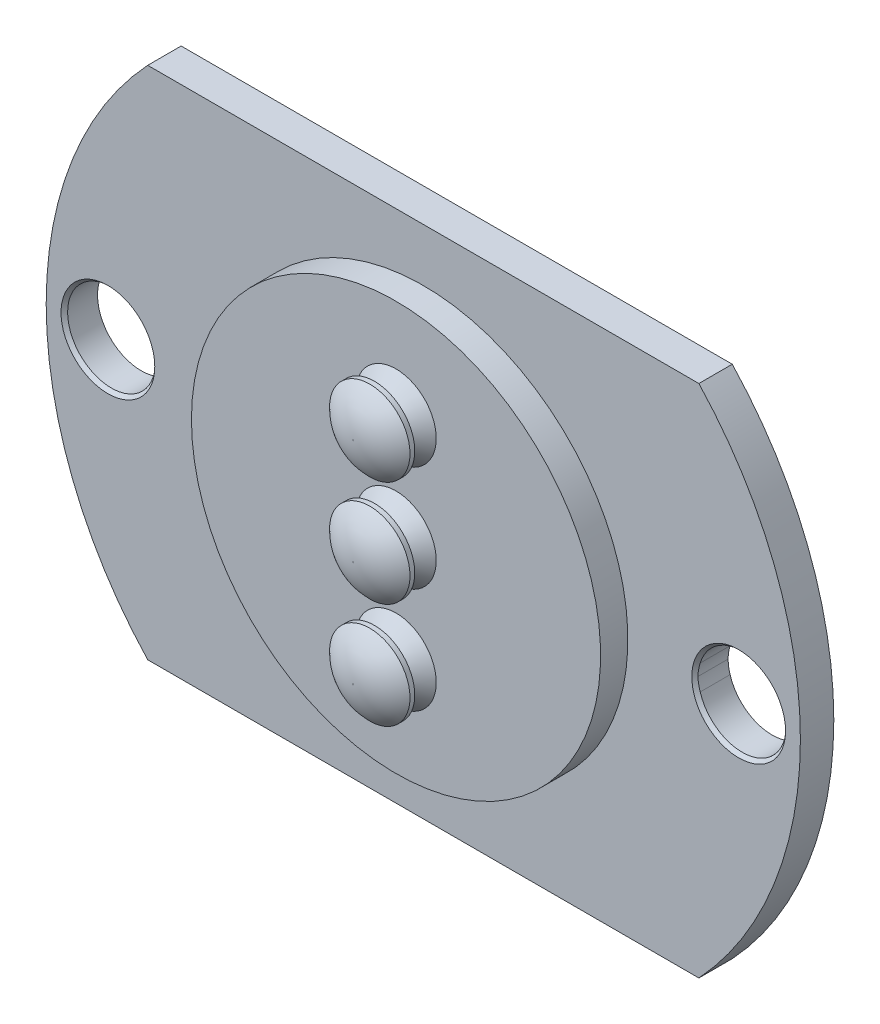
from build123d import *

# Parameters (mm, degrees)
CUT_EXTRUDE1_START                             = -7.3406
CUT_EXTRUDE1_OUTLINE_R                         = 1.4986
CUT_EXTRUDE1_DEPTH                             = 1.2446
CUT_EXTRUDE1_START_2                           = -8.3566
CUT_EXTRUDE1_2_OUTLINE_R                       = 6.985
CUT_EXTRUDE1_2_DEPTH                           = 3.5306
CUT_EXTRUDE1_START_3                           = -9.9568
CUT_EXTRUDE1_3_OUTLINE_R                       = 1.4986
CUT_EXTRUDE1_3_OUTLINE_R_2                     = 1.1176
CUT_EXTRUDE1_3_DEPTH                           = 9.9568
CUT_EXTRUDE1_4_OUTLINE_R                       = 7.62
CUT_EXTRUDE1_4_OUTLINE_R_2                     = 6.985
CUT_EXTRUDE1_4_DEPTH                           = 1.016
CUT_EXTRUDE1_5_OUTLINE_R                       = 1.1176
CUT_EXTRUDE1_5_DEPTH                           = 1.6002
CUT_EXTRUDE1_START_4                           = -4.826
CUT_EXTRUDE1_6_OUTLINE_R                       = 1.4986
CUT_EXTRUDE1_6_DEPTH                           = 0.508
CUT_EXTRUDE2_DEPTH                             = 19.066440786
CUT_EXTRUDE2_DEPTH_BACK                        = 19.066440786
SKETCH7_R                                      = 0.635
CUT_EXTRUDE3_DEPTH                             = 19.06644082
LPATTERN1_COUNT                                = 3
LPATTERN1_PITCH                                = 3.937
CSK_FOR_4_FLAT_HEAD_MACHINE_SCREW1_D           = 3.2639
CSK_FOR_4_FLAT_HEAD_MACHINE_SCREW1_CSINK_D     = 3.4925
CSK_FOR_4_FLAT_HEAD_MACHINE_SCREW1_CSINK_ANGLE = 82


with BuildPart() as part:
    # Cut-Extrude1: read off the stored shape, not the designer's step
    # Cut-Extrude1 outline → Cut-Extrude1 (new body)
    with BuildSketch(Plane(origin=(0, 0, -6.096), x_dir=(-1, 0, 0), z_dir=(0, 0, -1)).offset(CUT_EXTRUDE1_START)):
        with BuildLine():
            ThreePointArc((10.26432668, -9.5885), (14.0462, 0), (10.26432668, 9.5885))
            Line((10.26432668, 9.5885), (-10.26432668, 9.5885))
            ThreePointArc((-10.26432668, 9.5885), (-14.0462, 0), (-10.26432668, -9.5885))
            Line((-10.26432668, -9.5885), (10.26432668, -9.5885))
        make_face()
        with Locations((-11.6078, 0)):
            Circle(CUT_EXTRUDE1_OUTLINE_R, mode=Mode.SUBTRACT)
        with Locations((11.6078, 0)):
            Circle(CUT_EXTRUDE1_OUTLINE_R, mode=Mode.SUBTRACT)
    extrude(amount=CUT_EXTRUDE1_DEPTH)

    # Cut-Extrude1 2 outline → Cut-Extrude1 2 (add)
    with BuildSketch(Plane(origin=(0, 0, -6.096), x_dir=(-1, 0, 0), z_dir=(0, 0, -1)).offset(CUT_EXTRUDE1_START_2)):
        Circle(CUT_EXTRUDE1_2_OUTLINE_R)
    extrude(amount=CUT_EXTRUDE1_2_DEPTH)

    # Cut-Extrude1 3 outline → Cut-Extrude1 3 (add)
    # profile 1 of 3: a face of its own
    with BuildSketch(Plane(origin=(0, 0, -6.096), x_dir=(-1, 0, 0), z_dir=(0, 0, -1)).offset(CUT_EXTRUDE1_START_3)):
        with Locations((0, -3.937)):
            Circle(CUT_EXTRUDE1_3_OUTLINE_R)
        with Locations((0, -3.937)):
            Circle(CUT_EXTRUDE1_3_OUTLINE_R_2, mode=Mode.SUBTRACT)
    # profile 2 of 3: a face of its own
    with BuildSketch(Plane(origin=(0, 0, -6.096), x_dir=(-1, 0, 0), z_dir=(0, 0, -1)).offset(CUT_EXTRUDE1_START_3)):
        Circle(CUT_EXTRUDE1_3_OUTLINE_R)
        Circle(CUT_EXTRUDE1_3_OUTLINE_R_2, mode=Mode.SUBTRACT)
    # profile 3 of 3: a face of its own
    with BuildSketch(Plane(origin=(0, 0, -6.096), x_dir=(-1, 0, 0), z_dir=(0, 0, -1)).offset(CUT_EXTRUDE1_START_3)):
        with Locations((0, 3.937)):
            Circle(CUT_EXTRUDE1_3_OUTLINE_R)
        with Locations((0, 3.937)):
            Circle(CUT_EXTRUDE1_3_OUTLINE_R_2, mode=Mode.SUBTRACT)
    extrude(amount=CUT_EXTRUDE1_3_DEPTH)

    # Cut-Extrude1 4 outline → Cut-Extrude1 4 (add)
    with BuildSketch(Plane(origin=(0, 0, -6.096), x_dir=(-1, 0, 0), z_dir=(0, 0, -1)).offset(CUT_EXTRUDE1_START_2)):
        Circle(CUT_EXTRUDE1_4_OUTLINE_R)
        Circle(CUT_EXTRUDE1_4_OUTLINE_R_2, mode=Mode.SUBTRACT)
    extrude(amount=CUT_EXTRUDE1_4_DEPTH)

    # Cut-Extrude1 5 outline → Cut-Extrude1 5 (add)
    with BuildSketch(Plane(origin=(0, 0, -6.096), x_dir=(-1, 0, 0), z_dir=(0, 0, -1)).offset(CUT_EXTRUDE1_START_3)):
        with Locations((0, -3.937)):
            Circle(CUT_EXTRUDE1_5_OUTLINE_R)
        Circle(CUT_EXTRUDE1_5_OUTLINE_R)
        with Locations((0, 3.937)):
            Circle(CUT_EXTRUDE1_5_OUTLINE_R)
    extrude(amount=CUT_EXTRUDE1_5_DEPTH)

    # Cut-Extrude1 6 outline → Cut-Extrude1 6 (add)
    with BuildSketch(Plane(origin=(0, 0, -6.096), x_dir=(-1, 0, 0), z_dir=(0, 0, -1)).offset(CUT_EXTRUDE1_START_4)):
        with BuildLine():
            Line((-2.1971, 5.957789071), (-2.1971, -5.957789071))
            ThreePointArc((-2.1971, -5.957789071), (0, -6.349999923), (2.1971, -5.957789071))
            Line((2.1971, -5.957789071), (2.1971, 5.957789071))
            ThreePointArc((2.1971, 5.957789071), (0, 6.349999923), (-2.1971, 5.957789071))
        make_face()
        with Locations((0, -3.937)):
            Circle(CUT_EXTRUDE1_6_OUTLINE_R, mode=Mode.SUBTRACT)
        Circle(CUT_EXTRUDE1_6_OUTLINE_R, mode=Mode.SUBTRACT)
        with Locations((0, 3.937)):
            Circle(CUT_EXTRUDE1_6_OUTLINE_R, mode=Mode.SUBTRACT)
    extrude(amount=CUT_EXTRUDE1_6_DEPTH)

    # Sketch3 → Cut-Extrude2 (cut, two sides: drawn at the far end of the back side and taken through both)
    with BuildSketch(Plane(origin=(0, 0, 0), x_dir=(0, 0, -1), z_dir=(1, 0, 0)).offset(-CUT_EXTRUDE2_DEPTH_BACK)):
        with BuildLine():
            Line((4.097866667, -2.4384), (6.096, -2.4384))
            Line((6.096, -2.4384), (6.096, -4.436533333))
            ThreePointArc((6.096, -4.436533333), (4.68310637, -3.85129363), (4.097866667, -2.4384))
        make_face()
        with BuildLine():
            Line((6.096, -0.499533333), (6.096, 1.4986))
            Line((6.096, 1.4986), (4.097866667, 1.4986))
            ThreePointArc((4.097866667, 1.4986), (4.68310637, 0.08570637), (6.096, -0.499533333))
        make_face()
        with BuildLine():
            Line((6.096, 3.437466667), (6.096, 5.4356))
            Line((6.096, 5.4356), (4.097866667, 5.4356))
            ThreePointArc((4.097866667, 5.4356), (4.68310637, 4.02270637), (6.096, 3.437466667))
        make_face()
    extrude(amount=CUT_EXTRUDE2_DEPTH + CUT_EXTRUDE2_DEPTH_BACK, mode=Mode.SUBTRACT)

    # Sketch7 → Cut-Extrude3 (cut, through all)
    with BuildSketch(Plane(origin=(0, 0, 0), x_dir=(0, 0, -1), z_dir=(1, 0, 0))):
        with Locations(Location((2.794, 3.937, 0), (0, 0, 180))):
            Circle(SKETCH7_R)
        with Locations(Location((2.794, 0, 0), (0, 0, 180))):
            Circle(SKETCH7_R)
        with Locations(Location((2.794, -3.937, 0), (0, 0, 180))):
            Circle(SKETCH7_R)
    extrude(amount=CUT_EXTRUDE3_DEPTH, mode=Mode.SUBTRACT)

    # Sketch4 → Cut-Revolve1 (revolve, cut)
    with BuildSketch(Plane(origin=(0, 0, 0), x_dir=(0, 0, -1), z_dir=(1, 0, 0)), mode=Mode.PRIVATE) as cut_revolve1_sk:
        with BuildLine():
            Line((-3.2385, -2.4384), (-3.8608, -2.4384))
            Line((-3.8608, -2.4384), (-3.8608, -3.9116))
            ThreePointArc((-3.8608, -3.9116), (-3.698842777, -3.111978913), (-3.2385, -2.4384))
        make_face()
        Polygon((-3.0607, -2.4384), (-3.0607, -2.921), (-2.7432, -2.921), (-2.2606, -2.4384), align=None)
    cut_revolve1 = revolve(cut_revolve1_sk.sketch.rotate(Axis((0, -3.937, 3.8608), (0, 0, -1)), 90), axis=Axis((0, -3.937, 3.8608), (0, 0, -1)), mode=Mode.SUBTRACT)

    # LPattern1: Cut-Revolve1 ×3
    with Locations(*[(0, i * LPATTERN1_PITCH, 0) for i in range(1, LPATTERN1_COUNT)]):
        add(cut_revolve1, mode=Mode.SUBTRACT)

    # CSK for #4 Flat Head Machine Screw1 (through all)
    with Locations(Plane.XY.offset(1.2446)):
        with Locations((-11.7475, 0), (11.7475, 0)):
            CounterSinkHole(CSK_FOR_4_FLAT_HEAD_MACHINE_SCREW1_D / 2, CSK_FOR_4_FLAT_HEAD_MACHINE_SCREW1_CSINK_D / 2, counter_sink_angle=CSK_FOR_4_FLAT_HEAD_MACHINE_SCREW1_CSINK_ANGLE)


solid = part.part
